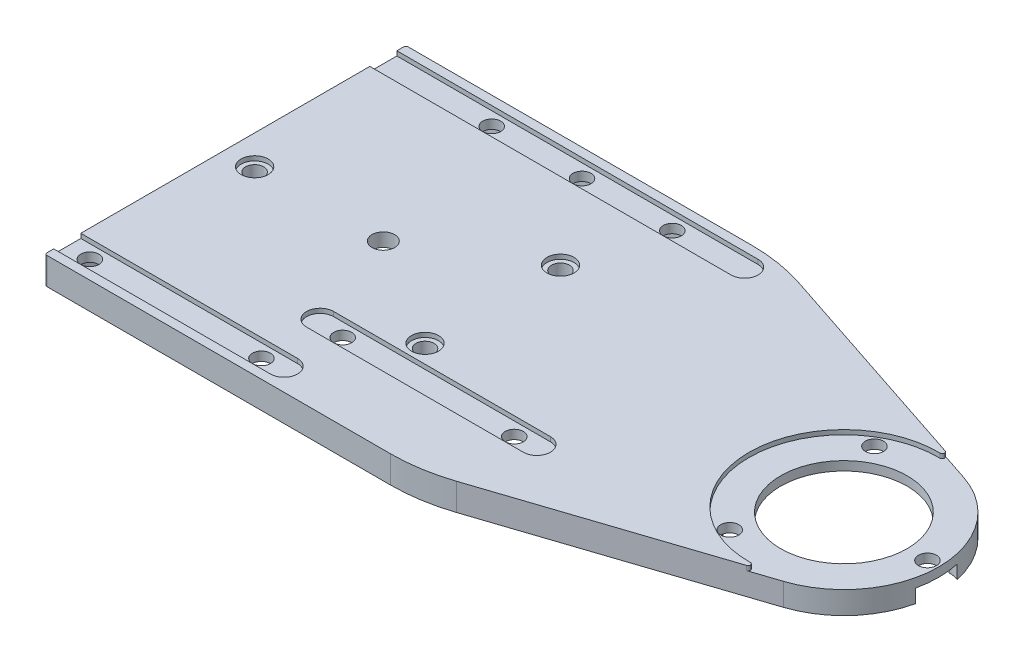
from build123d import *

# Parameters (mm, degrees)
EXTRUDE_1_DEPTH      = 6
SKETCH_6_R           = 14
CUT_EXTRUDE_4_DEPTH  = 10
SKETCH_7_R           = 2
CUT_EXTRUDE_5_DEPTH  = 10
SKETCH_10_R          = 2.5
SKETCH_10_R_2        = 2
CUT_EXTRUDE_7_DEPTH  = 10
CUT_EXTRUDE_8_DEPTH  = 1
CUT_EXTRUDE_9_DEPTH  = 1
CUT_EXTRUDE_10_DEPTH = 1
SKETCH_16_R          = 2
CUT_EXTRUDE_11_DEPTH = 10
SKETCH_17_R          = 2
CUT_EXTRUDE_12_DEPTH = 10
SKETCH_18_R          = 17.5
CUT_EXTRUDE_13_DEPTH = 3
FILLET_1_R           = 4
FILLET_2_R           = 4
FILLET_3_R           = 3
SKETCH_19_R          = 5
CUT_EXTRUDE_14_DEPTH = 3
SKETCH_20_R          = 19
SKETCH_20_R_2        = 14
CUT_EXTRUDE_15_DEPTH = 3
SKETCH_21_R          = 3
CUT_EXTRUDE_16_DEPTH = 1
SKETCH_22_R          = 5
SKETCH_22_R_2        = 2
EXTRUDE_2_DEPTH      = 3
FILLET_6_R           = 4
FILLET_7_R           = 4
FILLET_8_R           = 0.5
FILLET_9_R           = 40
FILLET_10_R          = 4
FILLET_11_R          = 3
FILLET_12_R          = 4
FILLET_13_R          = 3
CUT_EXTRUDE_START    = -1
SKETCH_23_R          = 21
CUT_EXTRUDE_17_DEPTH = 1
FILLET_14_R          = 0.5
EXTRUDE_START        = 3
EXTRUDE_3_DEPTH      = 3
FILLET_15_R          = 3
FILLET_16_R          = 3


# Some blends are built 0.0001 mm under size
with BuildPart() as part:
    # 草图1 → 凸台-拉伸1 (new body)
    with BuildSketch(Plane(origin=(0, 0, 0), x_dir=(1, 0, 0), z_dir=(0, 1, 0))):
        with BuildLine():
            Line((-13, 40), (70, 40))
            Line((70, 40), (130.600533748, 19.93572056))
            ThreePointArc((130.600533748, 19.93572056), (145, 0), (130.600533748, -19.93572056))
            Line((130.600533748, -19.93572056), (70, -40))
            Line((70, -40), (-13, -40))
            Line((-13, -40), (-13, 40))
        make_face()
    extrude(amount=EXTRUDE_1_DEPTH)

    # 草图6 → 切除-拉伸4 (cut)
    with BuildSketch(Plane(origin=(0, 6, 0), x_dir=(1, 0, 0), z_dir=(0, 1, 0))):
        with Locations(Location((124, 0, 0), (0, 0, 270))):
            Circle(SKETCH_6_R)
    extrude(amount=-CUT_EXTRUDE_4_DEPTH, mode=Mode.SUBTRACT)

    # 草图7 → 切除-拉伸5 (cut)
    with BuildSketch(Plane(origin=(0, 6, 0), x_dir=(1, 0, 0), z_dir=(0, 1, 0))):
        with Locations(Location((11, 35, 0), (0, 0, 270))):
            Circle(SKETCH_7_R)
        with Locations(Location((31, 35, 0), (0, 0, 270))):
            Circle(SKETCH_7_R)
        with Locations(Location((51, 35, 0), (0, 0, 270))):
            Circle(SKETCH_7_R)
    extrude(amount=-CUT_EXTRUDE_5_DEPTH, mode=Mode.SUBTRACT)

    # 草图10 → 切除-拉伸7 (cut)
    with BuildSketch(Plane(origin=(0, 6, 0), x_dir=(1, 0, 0), z_dir=(0, 1, 0))):
        with Locations(Location((22, 0, 0), (0, 0, 270))):
            Circle(SKETCH_10_R)
        with Locations(Location((-6.5, 0, 0), (0, 0, 270))):
            Circle(SKETCH_10_R_2)
        with Locations(Location((46.233241632, 15, 0), (0, 0, 270))):
            Circle(SKETCH_10_R_2)
        with Locations(Location((46.233241632, -15, 0), (0, 0, 270))):
            Circle(SKETCH_10_R_2)
    extrude(amount=-CUT_EXTRUDE_7_DEPTH, mode=Mode.SUBTRACT)

    # 草图11 → 切除-拉伸8 (cut)
    with BuildSketch(Plane(origin=(0, 6, 0), x_dir=(1, 0, 0), z_dir=(0, 1, 0))):
        with BuildLine():
            Line((-13, 38), (67, 38))
            ThreePointArc((67, 38), (70, 35), (67, 32))
            Line((67, 32), (-13, 32))
            Line((-13, 32), (-13, 38))
        make_face()
    extrude(amount=-CUT_EXTRUDE_8_DEPTH, mode=Mode.SUBTRACT)

    # 草图13 → 切除-拉伸9 (cut)
    with BuildSketch(Plane(origin=(0, 6, 0), x_dir=(1, 0, 0), z_dir=(0, 1, 0))):
        with BuildLine():
            Line((-13, -38), (35, -38))
            ThreePointArc((35, -38), (38, -35), (35, -32))
            Line((35, -32), (-13, -32))
            Line((-13, -32), (-13, -38))
        make_face()
    extrude(amount=-CUT_EXTRUDE_9_DEPTH, mode=Mode.SUBTRACT)

    # 草图14 → 切除-拉伸10 (cut)
    with BuildSketch(Plane(origin=(0, 6, 0), x_dir=(1, 0, 0), z_dir=(0, 1, 0))):
        with BuildLine():
            Line((78, -25), (30, -25))
            ThreePointArc((30, -25), (27, -22), (30, -19))
            Line((30, -19), (78, -19))
            ThreePointArc((78, -19), (81, -22), (78, -25))
        make_face()
    extrude(amount=-CUT_EXTRUDE_10_DEPTH, mode=Mode.SUBTRACT)

    # 草图16 → 切除-拉伸11 (cut)
    with BuildSketch(Plane(origin=(0, 6, 0), x_dir=(1, 0, 0), z_dir=(0, 1, 0))):
        with Locations(Location((142.5, 0, 0), (0, 0, 270))):
            Circle(SKETCH_16_R)
        with Locations(Location((114.75, -16.02146997, 0), (0, 0, 270))):
            Circle(SKETCH_16_R)
        with Locations(Location((114.75, 16.02146997, 0), (0, 0, 270))):
            Circle(SKETCH_16_R)
    extrude(amount=-CUT_EXTRUDE_11_DEPTH, mode=Mode.SUBTRACT)

    # 草图17 → 切除-拉伸12 (cut)
    with BuildSketch(Plane(origin=(0, 6, 0), x_dir=(1, 0, 0), z_dir=(0, 1, 0))):
        with Locations(Location((-8, -35, 0), (0, 0, 270))):
            Circle(SKETCH_17_R)
        with Locations(Location((30, -35, 0), (0, 0, 270))):
            Circle(SKETCH_17_R)
        with Locations(Location((35, -22, 0), (0, 0, 270))):
            Circle(SKETCH_17_R)
        with Locations(Location((73, -22, 0), (0, 0, 270))):
            Circle(SKETCH_17_R)
    extrude(amount=-CUT_EXTRUDE_12_DEPTH, mode=Mode.SUBTRACT)

    # 草图18 → 切除-拉伸13 (cut)
    with BuildSketch(Plane(origin=(0, 0, 0), x_dir=(-1, 0, 0), z_dir=(0, -1, 0))):
        with Locations(Location((-22, 0, 0), (0, 0, 90))):
            Circle(SKETCH_18_R)
        with BuildLine():
            Line((11, 38), (-19, 38))
            Line((-19, 38), (-19, 19.267848868))
            ThreePointArc((-19, 19.267848868), (-7.815135505, 13.380568719), (-2.590012873, 1.871469936))
            ThreePointArc((-2.590012873, 1.871469936), (-6.596442598, -11.957442008), (-19, -19.267848868))
            Line((-19, -19.267848868), (-19, -38))
            Line((-19, -38), (11, -38))
            Line((11, -38), (11, -1))
            Line((11, -1), (11, 38))
        make_face()
        with BuildLine():
            Line((-57, -38), (-69.677517158, -38))
            Line((-69.677517158, -38), (-129.971911486, -18.037080507))
            ThreePointArc((-129.971911486, -18.037080507), (-119.660846995, -18.497885047), (-110.630258043, -13.5))
            Line((-110.630258043, -13.5), (-57, -13.5))
            Line((-57, -13.5), (-57, -38))
        make_face()
        with BuildLine():
            Line((-21, 38), (-55, 38))
            Line((-55, 38), (-55, 1))
            Line((-55, 1), (-41.474342094, 1))
            ThreePointArc((-41.474342094, 1), (-35.063332573, 14.477546135), (-21, 19.474342094))
            Line((-21, 19.474342094), (-21, 38))
        make_face()
        with BuildLine():
            Line((-55, -38), (-21, -38))
            Line((-21, -38), (-21, -19.474342094))
            ThreePointArc((-21, -19.474342094), (-35.063332573, -14.477546135), (-41.474342094, -1))
            Line((-41.474342094, -1), (-55, -1))
            Line((-55, -1), (-55, -38))
        make_face()
        with BuildLine():
            Line((-57, -11.5), (-106.428716609, -11.5))
            ThreePointArc((-106.428716609, -11.5), (-103, 0), (-106.428716609, 11.5))
            Line((-106.428716609, 11.5), (-57, 11.5))
            Line((-57, 11.5), (-57, -11.5))
        make_face()
        with BuildLine():
            Line((-57, 13.5), (-57, 38))
            Line((-57, 38), (-69.677517158, 38))
            Line((-69.677517158, 38), (-129.971911486, 18.037080507))
            ThreePointArc((-129.971911486, 18.037080507), (-119.660846995, 18.497885047), (-110.630258043, 13.5))
            Line((-110.630258043, 13.5), (-57, 13.5))
        make_face()
    extrude(amount=-CUT_EXTRUDE_13_DEPTH, mode=Mode.SUBTRACT)

    # 圆角1
    fillet_1_edges = [part.edges().sort_by_distance(p)[0] for p in [
        (57, 1.5, -11.5),
        (57, 1.5, 11.5),
    ]]
    fillet(fillet_1_edges, radius=FILLET_1_R)

    # 圆角2
    fillet_2_edges = [part.edges().sort_by_distance(p)[0] for p in [
        (-11, 1.5, -38),
        (19, 1.5, -38),
        (57, 1.5, 13.5),
        (57, 1.5, 38),
        (69.677517158, 1.5, 38),
        (21, 1.5, -38),
        (55, 1.5, -38),
        (57, 1.5, -38),
        (57, 1.5, -13.5),
        (55, 1.5, 38),
        (55, 1.5, 1),
        (21, 1.5, 38),
    ]]
    fillet(fillet_2_edges, radius=FILLET_2_R)

    # 圆角3
    fillet_3_edges = [part.edges().sort_by_distance(p)[0] for p in [
        (-11, 1.5, 38),
    ]]
    fillet(fillet_3_edges, radius=FILLET_3_R)

    # 草图19 → 切除-拉伸14 (cut)
    with BuildSketch(Plane.XZ):
        with Locations((114.75, 16.02146997)):
            Circle(SKETCH_19_R)
        with Locations((142.5, 0)):
            Circle(SKETCH_19_R)
        with Locations((114.75, -16.02146997)):
            Circle(SKETCH_19_R)
    extrude(amount=-CUT_EXTRUDE_14_DEPTH, mode=Mode.SUBTRACT)

    # 草图20 → 切除-拉伸15 (cut)
    with BuildSketch(Plane.XZ):
        with Locations((124, 0)):
            Circle(SKETCH_20_R)
        with Locations(Location((124, 0, 0), (0, 0, 90))):
            Circle(SKETCH_20_R_2, mode=Mode.SUBTRACT)
    extrude(amount=-CUT_EXTRUDE_15_DEPTH, mode=Mode.SUBTRACT)

    # 草图21 → 切除-拉伸16 (cut)
    with BuildSketch(Plane(origin=(0, 6, 0), x_dir=(1, 0, 0), z_dir=(0, 1, 0))):
        with Locations(Location((-6.5, 0, 0), (0, 0, 270))):
            Circle(SKETCH_21_R)
        with Locations(Location((46.233241632, 15, 0), (0, 0, 270))):
            Circle(SKETCH_21_R)
        with Locations(Location((46.233241632, -15, 0), (0, 0, 270))):
            Circle(SKETCH_21_R)
    extrude(amount=-CUT_EXTRUDE_16_DEPTH, mode=Mode.SUBTRACT)

    # 草图22 → 凸台-拉伸2 (add)
    # profile 1 of 3: a face of its own
    with BuildSketch(Plane.XZ.offset(-3)):
        with Locations(Location((46.233241632, 15, 0), (0, 0, 270))):
            Circle(SKETCH_22_R)
        with Locations(Location((46.233241632, 15, 0), (0, 0, 90))):
            Circle(SKETCH_22_R_2, mode=Mode.SUBTRACT)
    # profile 2 of 3: a face of its own
    with BuildSketch(Plane.XZ.offset(-3)):
        with Locations(Location((46.233241632, -15, 0), (0, 0, 270))):
            Circle(SKETCH_22_R)
        with Locations(Location((46.233241632, -15, 0), (0, 0, 90))):
            Circle(SKETCH_22_R_2, mode=Mode.SUBTRACT)
    # profile 3 of 3: a face of its own
    with BuildSketch(Plane.XZ.offset(-3)):
        with Locations((-6.5, 0)):
            Circle(SKETCH_22_R)
        with Locations(Location((-6.5, 0, 0), (0, 0, 90))):
            Circle(SKETCH_22_R_2, mode=Mode.SUBTRACT)
    extrude(amount=EXTRUDE_2_DEPTH)

    # 圆角6
    fillet_6_edges = [part.edges().sort_by_distance(p)[0] for p in [
        (19, 1.5, 38),
    ]]
    fillet(fillet_6_edges, radius=FILLET_6_R)

    # 圆角7
    fillet_7_edges = [part.edges().sort_by_distance(p)[0] for p in [
        (55, 1.5, -1),
    ]]
    fillet(fillet_7_edges, radius=FILLET_7_R)

    # 圆角8
    fillet_8_edges = [part.edges().sort_by_distance(p)[0] for p in [
        (-13, 3, -40),
        (-13, 3, 40),
    ]]
    fillet(fillet_8_edges, radius=FILLET_8_R)

    # 圆角9
    fillet_9_edges = [part.edges().sort_by_distance(p)[0] for p in [
        (70, 3, -40),
        (70, 3, 40),
    ]]
    fillet(fillet_9_edges, radius=FILLET_9_R)

    # 圆角10
    fillet_10_edges = [part.edges().sort_by_distance(p)[0] for p in [
        (19, 1.5, 19.267848868),
        (19, 1.5, -19.267848868),
        (21, 1.5, -19.474342094),
        (41.474342094, 1.5, -1),
        (41.474342094, 1.5, 1),
        (21, 1.5, 19.474342094),
    ]]
    fillet(fillet_10_edges, radius=FILLET_10_R)

    # 圆角11
    fillet_11_edges = [part.edges().sort_by_distance(p)[0] for p in [
        (106.428716609, 1.5, 11.5),
        (106.428716609, 1.5, -11.5),
    ]]
    fillet(fillet_11_edges, radius=FILLET_11_R)

    # 圆角12
    fillet_12_edges = [part.edges().sort_by_distance(p)[0] for p in [
        (69.677517158, 1.5, -38),
    ]]
    fillet(fillet_12_edges, radius=FILLET_12_R)

    # 圆角13
    fillet_13_edges = [part.edges().sort_by_distance(p)[0] for p in [
        (-11, 1.5, -2.179449472),
        (-11, 1.5, 2.179449472),
    ]]
    fillet(fillet_13_edges, radius=FILLET_13_R)

    # 草图23 → 切除-拉伸17 (cut)
    with BuildSketch(Plane(origin=(0, 6, 0), x_dir=(1, 0, 0), z_dir=(0, 1, 0)).offset(CUT_EXTRUDE_START)):
        with Locations((124, 0)):
            Circle(SKETCH_23_R)
    extrude(amount=CUT_EXTRUDE_17_DEPTH, mode=Mode.SUBTRACT)

    # 圆角14
    fillet_14_edges = [part.edges().sort_by_distance(p)[0] for p in [
        (130.600533748, 5.5, 19.93572056),
    ]]
    fillet(fillet_14_edges, radius=FILLET_14_R)
    fillet_14_2_edges = [part.edges().sort_by_distance(p)[0] for p in [
        (130.600533748, 5.5, -19.93572056),
    ]]
    fillet(fillet_14_2_edges, radius=FILLET_14_R - 0.0001)  # a hair under: the kernel refuses the full size

    # 草图24 → 凸台-拉伸3 (add)
    with BuildSketch(Plane.XZ.offset(-3).offset(EXTRUDE_START)):
        with BuildLine():
            Line((-1.525062814, 0.5), (2.50641131, 0.5))
            ThreePointArc((2.50641131, 0.5), (2.5, 0), (2.50641131, -0.5))
            Line((2.50641131, -0.5), (-1.525062814, -0.5))
            ThreePointArc((-1.525062814, -0.5), (-1.5, 0), (-1.525062814, 0.5))
        make_face()
        with BuildLine():
            Line((38.312029649, 10.684928111), (41.739948477, 12.806756598))
            ThreePointArc((41.739948477, 12.806756598), (41.981795732, 12.368421053), (42.266264266, 11.956467418))
            Line((42.266264266, 11.956467418), (38.838345438, 9.834638931))
            ThreePointArc((38.838345438, 9.834638931), (38.580639011, 10.263157895), (38.312029649, 10.684928111))
        make_face()
        with BuildLine():
            Line((51.208178818, 14.5), (55, 14.5))
            Line((55, 14.5), (55, 15.5))
            Line((55, 15.5), (51.208178818, 15.5))
            ThreePointArc((51.208178818, 15.5), (51.233241632, 15), (51.208178818, 14.5))
        make_face()
    extrude_3 = extrude(amount=-EXTRUDE_3_DEPTH)

    # 圆角15
    # the kernel refuses this fillet: 3 mm, written as the material it adds along each edge
    with BuildSketch(Plane(origin=(38.312029649, 0, 10.684928111), x_dir=(-0.6013412021127245, 0, 0.7989923395387615), z_dir=(0, 1, 0)), Plane(origin=(2.50641131, 0, -0.5), x_dir=(0.09079163373399993, 0, -0.9958699108035705), z_dir=(0, 1, 0))) as fillet_15_piece_1:
        with BuildLine():
            CenterArc((2.739519588, 2.993611423), FILLET_15_R, 185.209150823, 81.050981935)
            Line((-0.248090144, 2.721236521), (0, 0))
            ThreePointArc((0, 0), (1.271919809, 0.041525754), (2.543839618, 0))
        make_face()
    extrude(amount=3)
    with BuildSketch(Plane(origin=(41.739948477, 0, 12.806756598), x_dir=(-0.8502891800738692, 0, -0.5263157894736842), z_dir=(0, 1, 0)), Plane(origin=(51.208178818, 0, 14.5), x_dir=(1, 0, 0), z_dir=(0, 1, 0))) as fillet_15_piece_2:
        with BuildLine():
            CenterArc((2.218810099, 3), FILLET_15_R, 205.944479772, 64.055520228)
            ThreePointArc((-0.478845132, 1.6875), (-0.164842304, 0.864912901), (0, 0))
            Line((0, 0), (2.218810099, 0))
        make_face()
    extrude(amount=3)
    with BuildSketch(Plane(origin=(55, 0, 15.5), x_dir=(0, 0, 1), z_dir=(0, 1, 0))) as fillet_15_piece_3:
        with BuildLine():
            CenterArc((FILLET_15_R, -FILLET_15_R), FILLET_15_R, 90, 90)
            Line((0, -FILLET_15_R), (0, 0))
            Line((0, 0), (FILLET_15_R, 0))
        make_face()
    extrude(amount=3)
    with BuildSketch(Plane(origin=(51.208178818, 0, 15.5), x_dir=(1, 0, 0), z_dir=(0, 1, 0)), Plane(origin=(42.266264266, 0, 11.956467418), x_dir=(-0.8502891800738686, 0, -0.526315789473685), z_dir=(0, 1, 0))) as fillet_15_piece_4:
        with BuildLine():
            CenterArc((2.218810099, -3), FILLET_15_R, 90, 64.055520228)
            ThreePointArc((-0.478845132, -1.6875), (-0.164842304, -0.864912901), (0, 0))
            Line((0, 0), (2.218810099, 0))
        make_face()
    extrude(amount=3)
    with BuildSketch(Plane(origin=(55, 0, 14.5), x_dir=(0, 0, -1), z_dir=(0, 1, 0))) as fillet_15_piece_5:
        with BuildLine():
            CenterArc((FILLET_15_R, FILLET_15_R), FILLET_15_R, 180, 90)
            Line((0, FILLET_15_R), (0, 0))
            Line((0, 0), (FILLET_15_R, 0))
        make_face()
    extrude(amount=3)
    with BuildSketch(Plane(origin=(38.838345438, 0, 9.834638931), x_dir=(0.44694291452484, 0, -0.894562480297515), z_dir=(0, 1, 0)), Plane(origin=(2.50641131, 0, 0.5), x_dir=(0.09079163373399997, 0, 0.9958699108035703), z_dir=(0, 1, 0))) as fillet_15_piece_6:
        with BuildLine():
            CenterArc((2.739519588, -2.993611423), FILLET_15_R, 93.739867242, 81.050981935)
            Line((-0.248090144, -2.721236521), (0, 0))
            ThreePointArc((0, 0), (1.271919809, -0.041525754), (2.543839618, 0))
        make_face()
    extrude(amount=3)
    with BuildSketch(Plane(origin=(-1.525062814, 0, 0.5), x_dir=(-0.2729825802189898, 0, 0.9620189763705198), z_dir=(0, 1, 0))) as fillet_15_piece_7:
        with BuildLine():
            CenterArc((2.280360423, 2.953485161), FILLET_15_R, 195.841825124, 64.055520228)
            Line((-0.605696506, 2.134537421), (0, 0))
            ThreePointArc((0, 0), (0.877061701, 0.077524731), (1.754123402, 0))
        make_face()
    extrude(amount=3)
    with BuildSketch(Plane(origin=(-1.525062814, 0, -0.5), x_dir=(-0.27298258021898997, 0, -0.9620189763705197), z_dir=(0, 1, 0))) as fillet_15_piece_8:
        with BuildLine():
            CenterArc((2.280360423, -2.953485161), FILLET_15_R, 100.102654648, 64.055520228)
            Line((-0.605696506, -2.134537421), (0, 0))
            ThreePointArc((0, 0), (0.877061701, -0.077524731), (1.754123402, 0))
        make_face()
    extrude(amount=3)

    # 镜向2: 凸台-拉伸3 across plane
    add(extrude_3.mirror(Plane.XY))

    # 圆角16
    # the kernel refuses this fillet: 3 mm, written as the material it adds along each edge
    with BuildSketch(Plane(origin=(38.838345438, 0, -9.834638931), x_dir=(0.4469429145248415, 0, 0.8945624802975141), z_dir=(0, 1, 0))) as fillet_16_piece_1:
        with BuildLine():
            CenterArc((2.739519588, 2.993611423), FILLET_16_R, 185.209150823, 81.050981935)
            Line((-0.248090144, 2.721236521), (0, 0))
            ThreePointArc((0, 0), (1.271919809, 0.041525754), (2.543839618, 0))
        make_face()
    extrude(amount=3)
    with BuildSketch(Plane(origin=(42.266264266, 0, -11.956467418), x_dir=(-0.8502891800738688, 0, 0.5263157894736846), z_dir=(0, 1, 0))) as fillet_16_piece_2:
        with BuildLine():
            CenterArc((2.218810099, 3), FILLET_16_R, 205.944479772, 64.055520228)
            ThreePointArc((-0.478845132, 1.6875), (-0.164842304, 0.864912901), (0, 0))
            Line((0, 0), (2.218810099, 0))
        make_face()
    extrude(amount=3)
    with BuildSketch(Plane(origin=(55, 0, -14.5), x_dir=(-1, 0, 0), z_dir=(0, 1, 0))) as fillet_16_piece_3:
        with BuildLine():
            CenterArc((FILLET_16_R, FILLET_16_R), FILLET_16_R, 180, 90)
            Line((0, FILLET_16_R), (0, 0))
            Line((0, 0), (FILLET_16_R, 0))
        make_face()
    extrude(amount=3)
    with BuildSketch(Plane(origin=(51.208178818, 0, -14.5), x_dir=(-0.27298258021898775, 0, 0.9620189763705204), z_dir=(0, 1, 0))) as fillet_16_piece_4:
        with BuildLine():
            CenterArc((2.280360423, 2.953485161), FILLET_16_R, 195.841825124, 64.055520228)
            Line((-0.605696506, 2.134537421), (0, 0))
            ThreePointArc((0, 0), (0.877061701, 0.077524731), (1.754123402, 0))
        make_face()
    extrude(amount=3)
    with BuildSketch(Plane(origin=(55, 0, -15.5), x_dir=(-1, 0, 0), z_dir=(0, 1, 0))) as fillet_16_piece_5_section:
        with BuildLine():
            CenterArc((FILLET_16_R, -FILLET_16_R), FILLET_16_R, 90, 90)
            Line((0, -FILLET_16_R), (0, 0))
            Line((0, 0), (FILLET_16_R, 0))
        make_face()
    fillet_16_piece_5 = extrude(amount=10.5, mode=Mode.PRIVATE)
    fillet_16_piece_5 = split(fillet_16_piece_5, bisect_by=Plane(origin=(54.329896183, 6, -16.170103817), z_dir=(0, -1, 0)), keep=Keep.TOP, mode=Mode.PRIVATE)
    add(fillet_16_piece_5)
    with BuildSketch(Plane(origin=(51.208178818, 0, -15.5), x_dir=(-0.27298258021898725, 0, -0.9620189763705206), z_dir=(0, 1, 0))) as fillet_16_piece_6_section:
        with BuildLine():
            CenterArc((2.280360423, -2.953485161), FILLET_16_R, 100.102654648, 64.055520228)
            Line((-0.605696506, -2.134537421), (0, 0))
            ThreePointArc((0, 0), (0.877061701, -0.077524731), (1.754123402, 0))
        make_face()
    fillet_16_piece_6 = extrude(amount=8.547025249, mode=Mode.PRIVATE)
    fillet_16_piece_6 = split(fillet_16_piece_6, bisect_by=Plane(origin=(51.640370366, 6, -15.87464797), z_dir=(0, -1, 0)), keep=Keep.TOP, mode=Mode.PRIVATE)
    add(fillet_16_piece_6)
    with BuildSketch(Plane(origin=(41.739948477, 0, -12.806756598), x_dir=(-0.27421164272824833, 0, -0.9616693688541169), z_dir=(0, 1, 0))) as fillet_16_piece_7_section:
        with BuildLine():
            CenterArc((2.280360423, 2.953485161), FILLET_16_R, 195.841825124, 64.055520228)
            Line((-0.605696506, 2.134537421), (0, 0))
            ThreePointArc((0, 0), (0.877061701, 0.077524731), (1.754123402, 0))
        make_face()
    fillet_16_piece_7 = extrude(amount=8.547025249, mode=Mode.PRIVATE)
    fillet_16_piece_7 = split(fillet_16_piece_7, bisect_by=Plane(origin=(41.175277537, 6, -12.897846477), z_dir=(0, -1, 0)), keep=Keep.TOP, mode=Mode.PRIVATE)
    add(fillet_16_piece_7)
    with BuildSketch(Plane(origin=(38.312029649, 0, -10.684928111), x_dir=(-0.6013412021127245, 0, -0.7989923395387615), z_dir=(0, 1, 0))) as fillet_16_piece_8_section:
        with BuildLine():
            CenterArc((2.739519588, -2.993611423), FILLET_16_R, 93.739867242, 81.050981935)
            Line((-0.248090144, -2.721236521), (0, 0))
            ThreePointArc((0, 0), (1.271919809, -0.041525754), (2.543839618, 0))
        make_face()
    fillet_16_piece_8 = extrude(amount=9.831305203, mode=Mode.PRIVATE)
    fillet_16_piece_8 = split(fillet_16_piece_8, bisect_by=Plane(origin=(38.510442065, 6, -11.468214263), z_dir=(0, -1, 0)), keep=Keep.TOP, mode=Mode.PRIVATE)
    add(fillet_16_piece_8)


solid = part.part
